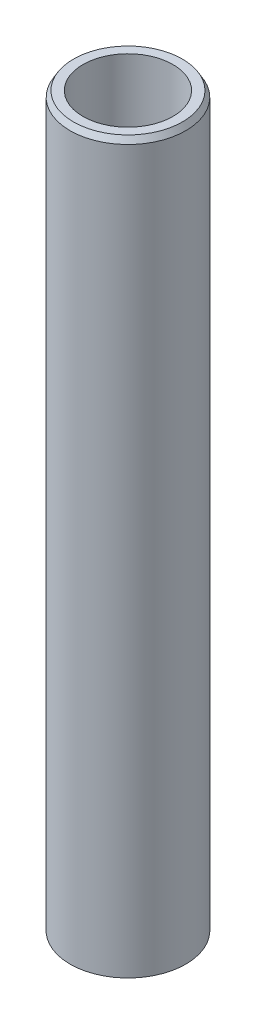
from build123d import *
from OCP.BRepFilletAPI import BRepFilletAPI_MakeChamfer

# Parameters (mm, degrees)
SKETCH1_R           = 47.5
BOSS_EXTRUDE1_DEPTH = 600
SKETCH2_R           = 36.937818953
CUT_EXTRUDE1_DEPTH  = 604.748706003
CHAMFER1_SIZE       = 4.829677063
CHAMFER1_SIZE2      = 2.788415352


with BuildPart() as part:
    # Sketch1 → Boss-Extrude1 (new body)
    with BuildSketch(Plane(origin=(0, 0, 0), x_dir=(1, 0, 0), z_dir=(0, 1, 0))):
        Circle(SKETCH1_R)
    extrude(amount=BOSS_EXTRUDE1_DEPTH)

    # Sketch2 → Cut-Extrude1 (cut, through all)
    with BuildSketch(Plane(origin=(0, 0, 0), x_dir=(1, 0, 0), z_dir=(0, 1, 0))):
        Circle(SKETCH2_R)
    extrude(amount=CUT_EXTRUDE1_DEPTH, mode=Mode.SUBTRACT)

    # Chamfer1: one chamfer whose edges measure the first distance from different faces: ONE call of the kernel's chamfer builder (chamfer() names one face for all edges)
    chamfer1_edges_1 = [part.edges().sort_by_distance(p)[0] for p in [
        (-47.5, 600, 0),
    ]]
    chamfer1_side_1 = [part.faces().sort_by_distance(p)[0] for p in [
        (-47.5, 300, 0),
    ]]
    chamfer1_edges_2 = [part.edges().sort_by_distance(p)[0] for p in [
        (-47.5, 0, 0),
    ]]
    chamfer1_side_2 = [part.faces().sort_by_distance(p)[0] for p in [
        (-46.156497116, 0, 0),
    ]]
    chamfer1 = BRepFilletAPI_MakeChamfer(part.part.solid().wrapped)
    for e in chamfer1_edges_1:
        chamfer1.Add(CHAMFER1_SIZE, CHAMFER1_SIZE2, e.wrapped, chamfer1_side_1[0].wrapped)  # the first distance lies on this face
    for e in chamfer1_edges_2:
        chamfer1.Add(CHAMFER1_SIZE, CHAMFER1_SIZE2, e.wrapped, chamfer1_side_2[0].wrapped)  # the first distance lies on this face
    add(Compound.cast(chamfer1.Shape()), mode=Mode.REPLACE)


solid = part.part
